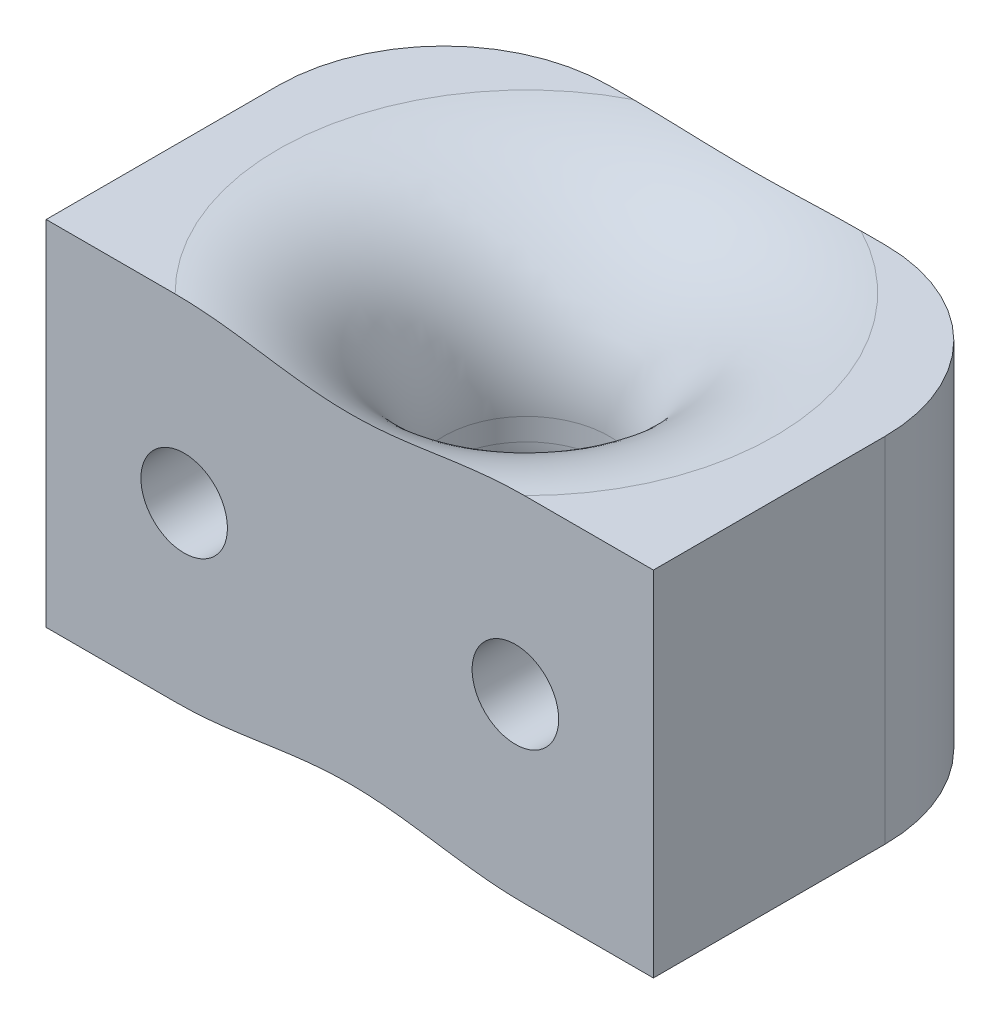
from build123d import *

# Parameters (mm, degrees)
BOSS_EXTRUDE1_DEPTH                             = 10.16
BOSS_EXTRUDE1_DEPTH_BACK                        = 12.7
SKETCH2_W                                       = 34.925
SKETCH2_H                                       = 20.32
SKETCH2_R                                       = 2.4892
SKETCH3_R                                       = 4.7625
CUT_EXTRUDE1_DEPTH                              = 43.35502361
CBORE_FOR_10_SOCKET_HEAD_CAP_SCREW1_D           = 4.9784
CBORE_FOR_10_SOCKET_HEAD_CAP_SCREW1_CBORE_D     = 9.525
CBORE_FOR_10_SOCKET_HEAD_CAP_SCREW1_CBORE_DEPTH = 4.826
FILLET1_R                                       = 9.525


with BuildPart() as part:
    # Sketch2 → Boss-Extrude1 (new, two sides: drawn at the far end of the back side and taken through both)
    with BuildSketch(Plane.XY.offset(-BOSS_EXTRUDE1_DEPTH_BACK)):
        with Locations((-17.4625, 10.16)):
            Rectangle(SKETCH2_W, SKETCH2_H)
        with Locations((-7.9375, 10.16)):
            Circle(SKETCH2_R, mode=Mode.SUBTRACT)
        with Locations((-26.9875, 10.16)):
            Circle(SKETCH2_R, mode=Mode.SUBTRACT)
    extrude(amount=BOSS_EXTRUDE1_DEPTH + BOSS_EXTRUDE1_DEPTH_BACK)

    # Sketch3 → Cut-Extrude1 (cut, through all)
    with BuildSketch(Plane.XZ):
        with Locations((-17.4625, 0)):
            Circle(SKETCH3_R)
    extrude(amount=-CUT_EXTRUDE1_DEPTH, mode=Mode.SUBTRACT)

    # Sketch4 → Cut-Revolve1 (revolve, cut)
    with BuildSketch(Plane.XY, mode=Mode.PRIVATE) as cut_revolve1_sk:
        with BuildLine():
            Line((-31.75, 20.32), (-17.4625, 20.32))
            Line((-17.4625, 20.32), (-17.4625, 0))
            Line((-17.4625, 0), (-31.75, 0))
            ThreePointArc((-31.75, 0), (-25.014807909, 2.789807909), (-22.225, 9.525))
            Line((-22.225, 9.525), (-22.225, 10.795))
            ThreePointArc((-22.225, 10.795), (-25.014807909, 17.530192091), (-31.75, 20.32))
        make_face()
    revolve(cut_revolve1_sk.sketch.rotate(Axis((-17.4625, 20.32, 0), (0, -1, 0)), 270), axis=Axis((-17.4625, 20.32, 0), (0, -1, 0)), mode=Mode.SUBTRACT)

    # CBORE for #10 Socket Head Cap Screw1 (through all)
    with Locations(Plane(origin=(0, 0, -12.7), x_dir=(-1, 0, 0), z_dir=(0, 0, -1))):
        with Locations((26.9875, 10.16), (7.9375, 10.16)):
            CounterBoreHole(CBORE_FOR_10_SOCKET_HEAD_CAP_SCREW1_D / 2, CBORE_FOR_10_SOCKET_HEAD_CAP_SCREW1_CBORE_D / 2, CBORE_FOR_10_SOCKET_HEAD_CAP_SCREW1_CBORE_DEPTH)

    # Fillet1
    # the kernel refuses this fillet: 9.525 mm, written as the material it takes off along each edge
    with BuildSketch(Plane(origin=(-34.925, -23.8125, -12.7), x_dir=(1, 0, 0), z_dir=(0, 1, 0))) as fillet1_piece_1:
        with BuildLine():
            CenterArc((FILLET1_R, -FILLET1_R), FILLET1_R, 90, 90)
            Line((0, -FILLET1_R), (0, 0))
            Line((0, 0), (FILLET1_R, 0))
        make_face()
    extrude(amount=67.945, mode=Mode.SUBTRACT)
    with BuildSketch(Plane(origin=(0, 44.1325, -12.7), x_dir=(0, 0, 1), z_dir=(0, -1, 0))) as fillet1_piece_2:
        with BuildLine():
            CenterArc((FILLET1_R, FILLET1_R), FILLET1_R, 180, 90)
            Line((0, FILLET1_R), (0, 0))
            Line((0, 0), (FILLET1_R, 0))
        make_face()
    extrude(amount=67.945, mode=Mode.SUBTRACT)


solid = part.part
